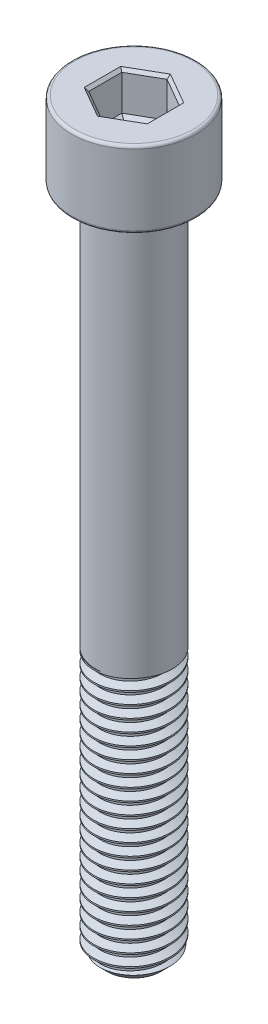
from build123d import *

# Parameters (mm, degrees)
SKETCH1_R           = 4
BOSS_EXTRUDE1_DEPTH = 28
THREAD1_PITCH       = 1.25
SKETCH2_R           = 4
BOSS_EXTRUDE2_DEPTH = 42
SKETCH5_R           = 6.5
BOSS_EXTRUDE3_DEPTH = 8
FILLET1_R           = 0.3
CUT_EXTRUDE1_DEPTH  = 4
CHAMFER1_SIZE       = 0.3
CUT_EXTRUDE2_DEPTH  = 0.4
CUT_EXTRUDE2_DRAFT  = -60


with BuildPart() as part:
    # Sketch1 → Boss-Extrude1 (new body)
    with BuildSketch(Plane(origin=(0, 0, 0), x_dir=(1, 0, 0), z_dir=(0, 1, 0))):
        with Locations(Location((0, 0, 0), (0, 0, 270))):
            Circle(SKETCH1_R)
    extrude(amount=BOSS_EXTRUDE1_DEPTH)

    # Thread1: the profile of Thread Profile1 profile screwed along a right-hand helix of 24 turns, 8 arcs to a turn; built about Z, then put on its axis
    thread1_z = Axis((0, 0, 0), (0, 0, 1))
    thread1_corners = [(4.0003, 0, -0.000173205), (4.0003, 0, 1.093923202), (3.323417656, 0, 0.703124998), (3.323417656, 0, 0.390624998)]
    with BuildLine(mode=Mode.PRIVATE) as thread1_profile:
        Line(thread1_corners[0], thread1_corners[1])
        Line(thread1_corners[1], thread1_corners[2])
        Line(thread1_corners[2], thread1_corners[3])
        Line(thread1_corners[3], thread1_corners[0])
    thread1_cap = Face(thread1_profile.wire())
    thread1_turn_angles = [0, 22.5, 45, 67.5, 90, 112.5, 135, 157.5, 180, 202.5, 225, 247.5, 270, 292.5, 315, 337.5, 360]
    thread1_turn_weights = [1, 0.9238795325112867, 1, 0.9238795325112867, 1, 0.9238795325112867, 1, 0.9238795325112867, 1, 0.9238795325112867, 1, 0.9238795325112867, 1, 0.9238795325112867, 1, 0.9238795325112867, 1]
    thread1_turn_rails = [Edge.make_bspline([Vector(p[0], p[1], 0).rotate(thread1_z, thread1_turn_angles[k]) / thread1_turn_weights[k] + Vector(0, 0, p[2] + THREAD1_PITCH * thread1_turn_angles[k] / 360) for k in range(17)], [0, 0, 0, 1, 1, 2, 2, 3, 3, 4, 4, 5, 5, 6, 6, 7, 7, 8, 8, 8], 2, thread1_turn_weights) for p in thread1_corners]
    thread1_turn_sides = [Face.make_surface_from_curves(thread1_turn_rails[p[0]], thread1_turn_rails[p[1]]) for p in [(0, 1), (1, 2), (2, 3), (3, 0)]]
    thread1 = Plane(origin=(0, 30, 0), x_dir=(-1, 0, 0), z_dir=(0, -1, 0)) * Solid(Shell([*[p.moved(Location((0, 0, THREAD1_PITCH * i))) for i in range(24) for p in thread1_turn_sides], thread1_cap, thread1_cap.rotate(thread1_z, 8640).moved(Location((0, 0, THREAD1_PITCH * 8640 / 360)))]))
    add(thread1, mode=Mode.SUBTRACT)

    # Sketch2 → Boss-Extrude2 (add)
    with BuildSketch(Plane(origin=(0, 28, 0), x_dir=(1, 0, 0), z_dir=(0, 1, 0))):
        with Locations(Location((0, 0, 0), (0, 0, 117.593571361))):
            Circle(SKETCH2_R)
    extrude(amount=BOSS_EXTRUDE2_DEPTH)

    # Sketch5 → Boss-Extrude3 (add)
    with BuildSketch(Plane(origin=(0, 70, 0), x_dir=(1, 0, 0), z_dir=(0, 1, 0))):
        with Locations(Location((0, 0, 0), (0, 0, 270))):
            Circle(SKETCH5_R)
    extrude(amount=BOSS_EXTRUDE3_DEPTH)

    # Sketch6 → Cut-Revolve1 (revolve, cut)
    with BuildSketch(Plane.XY, mode=Mode.PRIVATE) as cut_revolve1_sk:
        Polygon((4.01, 0), (4.01, 1.2), (2.81, 0), align=None)
    revolve(cut_revolve1_sk.sketch.rotate(Axis((0, 0, 0), (0, 1, 0)), 117.593571361), axis=Axis((0, 0, 0), (0, 1, 0)), mode=Mode.SUBTRACT)

    # Fillet1
    fillet1_edges = [part.edges().sort_by_distance(p)[0] for p in [
        (0, 70, -6.5),
        (0, 78, -6.5),
    ]]
    fillet(fillet1_edges, radius=FILLET1_R)

    # Sketch7 → Cut-Extrude1 (cut)
    with BuildSketch(Plane(origin=(0, 78, 0), x_dir=(1, 0, 0), z_dir=(0, 1, 0))):
        Polygon((0, 3.464101615), (-3, 1.732050808), (-3, -1.732050808), (0, -3.464101615), (3, -1.732050808), (3, 1.732050808), align=None)
    extrude(amount=-CUT_EXTRUDE1_DEPTH, mode=Mode.SUBTRACT)

    # Chamfer1
    chamfer1_edges = [part.edges().sort_by_distance(p)[0] for p in [
        (1.5, 78, -2.598076211),
        (-1.5, 78, -2.598076211),
        (-3, 78, 0),
        (-1.5, 78, 2.598076211),
        (1.5, 78, 2.598076211),
        (3, 78, 0),
    ]]
    chamfer(chamfer1_edges, length=CHAMFER1_SIZE)


with BuildPart() as cut_extrude2_tool:
    # Sketch8 → Cut-Extrude2 (with draft: the straight prism first)
    with BuildSketch(Plane(origin=(0, 74, 0), x_dir=(1, 0, 0), z_dir=(0, 1, 0))):
        Polygon((0, 3.464101615), (-3, 1.732050808), (-3, -1.732050808), (0, -3.464101615), (3, -1.732050808), (3, 1.732050808), align=None)
    extrude(amount=-CUT_EXTRUDE2_DEPTH)
    # Cut-Extrude2: the draft: its side faces are tilted about the plane it starts from
    cut_extrude2_sides = [cut_extrude2_tool.faces().sort_by_distance(p)[0] for p in [
        (-1.5, 73.8, -2.598076211),
        (-3, 73.8, 0),
        (-1.5, 73.8, 2.598076211),
        (1.5, 73.8, 2.598076211),
        (3, 73.8, 0),
        (1.5, 73.8, -2.598076211),
    ]]
    draft(cut_extrude2_sides, Plane(origin=(0, 74, 0), x_dir=(1, 0, 0), z_dir=(0, 1, 0)), CUT_EXTRUDE2_DRAFT)


with BuildPart() as part_1:
    add(part.part)

    # Cut-Extrude2: cut by cut_extrude2_tool
    add(cut_extrude2_tool.part, mode=Mode.SUBTRACT)


solid = part_1.part
